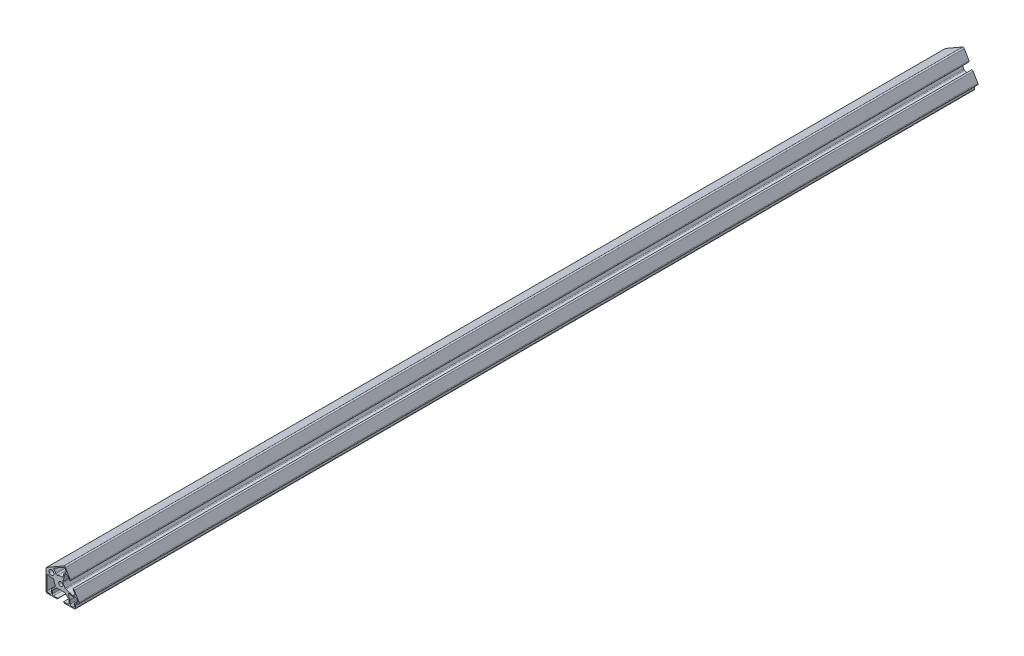
from build123d import *

# Parameters (mm, degrees)
SKETCH1_R           = 2.092304845
BOSS_EXTRUDE1_DEPTH = 913.638
FILLET1_R           = 1.27
FILLET2_R           = 1.27
FILLET3_R           = 1.27
FILLET4_R           = 1.27
FILLET5_R           = 1.27
FILLET6_R           = 1.27
FILLET7_R           = 1.27
FILLET8_R           = 1.27
FILLET9_R           = 1.27
FILLET10_R          = 1.27
FILLET11_R          = 1.27
FILLET12_R          = 1.27


with BuildPart() as part:
    # Sketch1 → Boss-Extrude1 (new body)
    with BuildSketch(Plane.XY):
        Polygon((-5.709111752, 22.288452484), (-4.843086348, 22.788452484), (-10.843086348, 33.180757329), (-30.000008327, 22.120503268), (-30.000008327, 0), (-18.0000002, 0), (-18.0000002, 1), (-23.500000006, 1), (-23.500000006, 5.300000062), (-19.200000068, 9.6), (-10.7, 9.6), (-6.5, 5.4), (-6.5, 1), (-11.999999876, 1), (-11.999999876, 0), (0, 0), (0, 4.8), (4.156920206, 7.199999), (-1.843078924, 17.592302339), (-2.709103466, 17.092304845), (0.040888209, 12.329160408), (-2.350417658, 10.948553557), (-10.326319052, 13.085689909), (-12.987541577, 17.695062532), (-10.850405232, 25.670963952), (-8.459105552, 27.051581466), align=None)
        with BuildLine():
            Line((-24.500008532, 1), (-29.00000835, 1))
            Line((-29.00000835, 1), (-29.00000835, 19.456837393))
            ThreePointArc((-29.00000835, 19.456837393), (-26.689110252, 16.43231636), (-22.891878185, 16.169626182))
            ThreePointArc((-22.891878185, 16.169626182), (-22.194595414, 16.497090044), (-21.561428455, 16.935878658))
            ThreePointArc((-21.561428455, 16.935878658), (-21.66355866, 13.451778233), (-20.035811579, 10.369599493))
            Line((-20.035811579, 10.369599493), (-20.872797194, 9.599995438))
            Line((-20.872797194, 9.599995438), (-24.500008532, 5.9727841))
            Line((-24.500008532, 5.9727841), (-24.500008532, 1))
        make_face(mode=Mode.SUBTRACT)
        with Locations((-15.000008327, 14.999995205)):
            Circle(SKETCH1_R, mode=Mode.SUBTRACT)
        with BuildLine():
            Line((-2.209115566, 9.875409102), (0.540892748, 11.463127143))
            Line((0.540892748, 11.463127143), (2.790879962, 7.566015836))
            Line((2.790879962, 7.566015836), (-1, 5.377350269))
            Line((-1, 5.377350269), (-1, 1))
            Line((-1, 1), (-5.5, 1))
            Line((-5.5, 1), (-5.5, 5.752344548))
            Line((-5.5, 5.752344548), (-7.208180578, 8.711011985))
            ThreePointArc((-7.208180578, 8.711011985), (-6.939845297, 10.769055524), (-4.872208764, 10.588982774))
            Line((-4.872208764, 10.588982774), (-2.209115566, 9.875409102))
        make_face(mode=Mode.SUBTRACT)
        with BuildLine():
            ThreePointArc((-25.041331703, 18.059304934), (-26.0647274, 22.449778327), (-22.000008327, 20.499995205))
            ThreePointArc((-22.000008327, 20.499995205), (-22.935289253, 18.550212084), (-25.041331703, 18.059304934))
        make_face(mode=Mode.SUBTRACT)
        with BuildLine():
            Line((-11.209111752, 31.814731926), (-8.959116197, 27.917625308))
            Line((-8.959116197, 27.917625308), (-11.709116867, 26.329911808))
            Line((-11.709116867, 26.329911808), (-12.992600022, 21.539887463))
            ThreePointArc((-12.992600022, 21.539887463), (-16.72657734, 21.619575123), (-19.945942173, 19.726264054))
            ThreePointArc((-19.945942173, 19.726264054), (-20.570023631, 22.927627533), (-23.153409445, 24.918688437))
            Line((-23.153409445, 24.918688437), (-11.209111752, 31.814731926))
        make_face(mode=Mode.SUBTRACT)
    extrude(amount=BOSS_EXTRUDE1_DEPTH)

    # Fillet1
    fillet1_edges = [part.edges().sort_by_distance(p)[0] for p in [
        (-11.709116867, 26.329911808, 456.819),
        (-11.209111752, 31.814731926, 456.819),
        (4.156920206, 7.199999, 456.819),
        (0, 0, 456.819),
        (-10.7, 9.6, 456.819),
        (-19.200000068, 9.6, 456.819),
        (-30.000008327, 0, 456.819),
        (-30.000008327, 22.120503268, 456.819),
        (-2.209115566, 9.875409102, 456.819),
    ]]
    fillet(fillet1_edges, radius=FILLET1_R)

    # Fillet2
    # the kernel refuses this fillet: 1.27 mm, written as the material it adds along each edge
    with BuildSketch(Plane(origin=(-6.5, 5.4, 0), x_dir=(-0.7071067811865475, 0.7071067811865475, 0), z_dir=(0, 0, 1))) as fillet2_piece_1:
        with BuildLine():
            CenterArc((FILLET2_R * 0.414213562373, FILLET2_R), FILLET2_R, 225, 45)
            Line((-FILLET2_R * 0.292893218813, FILLET2_R * 0.292893218813), (-FILLET2_R * 0.307035354437, FILLET2_R * 0.27875108319))
            Line((-FILLET2_R * 0.307035354437, FILLET2_R * 0.27875108319), (-FILLET2_R * 0.00828427124746, -FILLET2_R * 0.02))
            Line((-FILLET2_R * 0.00828427124746, -FILLET2_R * 0.02), (FILLET2_R * 0.414213562373, -FILLET2_R * 0.02))
            Line((FILLET2_R * 0.414213562373, -FILLET2_R * 0.02), (FILLET2_R * 0.414213562373, 0))
        make_face()
    extrude(amount=913.638)
    # the kernel refuses this fillet: 1.27 mm, written as the material it adds along each edge
    with BuildSketch(Plane(origin=(-20.035811579, 10.369599493, 0), x_dir=(-0.736116223784905, -0.6768551581251718, 0), z_dir=(0, 0, 1))) as fillet2_2_piece_1:
        with BuildLine():
            CenterArc((1.170024806, -1.269571301), FILLET2_R, 91.488758863, 79.506059356)
            Line((-0.084321413, -1.070786087), (-0.109408338, -1.066810383))
            ThreePointArc((-0.109408338, -1.066810383), (-0.046434543, -0.535056491), (-0.0254, 0))
            Line((-0.0254, 0), (0, 0.0254))
            ThreePointArc((0, 0.0254), (0.568514582, 0.0254), (1.136369252, 0.025391426))
            Line((1.136369252, 0.025391426), (1.137029165, 0))
        make_face()
    extrude(amount=913.638)
    # the kernel refuses this fillet: 1.27 mm, written as the material it takes off along each edge
    with BuildSketch(Plane(origin=(-24.500008532, 5.9727841, -1.315128061), x_dir=(0, -1, 0), z_dir=(0, 0, 1))) as fillet2_3_piece_1:
        with BuildLine():
            CenterArc((FILLET2_R * 0.414213562373, FILLET2_R), FILLET2_R, 225, 45)
            Line((-FILLET2_R * 0.292893218813, FILLET2_R * 0.292893218813), (-FILLET2_R * 0.307035354437, FILLET2_R * 0.27875108319))
            Line((-FILLET2_R * 0.307035354437, FILLET2_R * 0.27875108319), (-FILLET2_R * 0.00828427124746, -FILLET2_R * 0.02))
            Line((-FILLET2_R * 0.00828427124746, -FILLET2_R * 0.02), (FILLET2_R * 0.414213562373, -FILLET2_R * 0.02))
            Line((FILLET2_R * 0.414213562373, -FILLET2_R * 0.02), (FILLET2_R * 0.414213562373, 0))
        make_face()
    extrude(amount=916.268256121, mode=Mode.SUBTRACT)

    # Fillet3
    fillet3_edges = [part.edges().sort_by_distance(p)[0] for p in [
        (-23.500000006, 5.300000062, 456.819),
        (-10.850405232, 25.670963952, 456.819),
        (-12.987541577, 17.695062532, 456.819),
    ]]
    fillet(fillet3_edges, radius=FILLET3_R)

    # Fillet4
    fillet4_edges = [part.edges().sort_by_distance(p)[0] for p in [
        (-10.326319052, 13.085689909, 456.819),
        (-2.350417658, 10.948553557, 456.819),
    ]]
    fillet(fillet4_edges, radius=FILLET4_R)

    # Fillet5
    fillet5_edges = [part.edges().sort_by_distance(p)[0] for p in [
        (2.790879962, 7.566015836, 456.819),
        (0.540892748, 11.463127143, 456.819),
        (-1, 5.377350269, 456.819),
        (-4.872208764, 10.588982774, 456.819),
    ]]
    fillet(fillet5_edges, radius=FILLET5_R)

    # Fillet6
    fillet6_edges = [part.edges().sort_by_distance(p)[0] for p in [
        (-29.00000835, 1, 456.819),
        (-24.500008532, 1, 456.819),
        (-6.5, 1, 456.819),
        (-23.500000006, 1, 456.819),
        (-5.5, 5.752344548, 456.819),
        (-5.5, 1, 456.819),
        (-1, 1, 456.819),
    ]]
    fillet(fillet6_edges, radius=FILLET6_R)

    # Fillet7
    fillet7_edges = [part.edges().sort_by_distance(p)[0] for p in [
        (-8.959116197, 27.917625308, 456.819),
        (-19.945942173, 19.726264054, 456.819),
        (-12.992600022, 21.539887463, 456.819),
        (-21.561428455, 16.935878658, 456.819),
        (0.040888209, 12.329160408, 456.819),
        (-8.459105552, 27.051581466, 456.819),
    ]]
    fillet(fillet7_edges, radius=FILLET7_R)

    # Fillet8
    fillet8_edges = [part.edges().sort_by_distance(p)[0] for p in [
        (-23.153409445, 24.918688437, 456.819),
        (0, 4.8, 456.819),
    ]]
    fillet(fillet8_edges, radius=FILLET8_R)

    # Fillet9
    fillet9_edges = [part.edges().sort_by_distance(p)[0] for p in [
        (-29.00000835, 19.456837393, 456.819),
    ]]
    fillet(fillet9_edges, radius=FILLET9_R)

    # Fillet10
    # the kernel refuses this fillet: 1.27 mm, written as the material it takes off along each edge
    with BuildSketch(Plane(origin=(-11.999999876, 0, -3.102418412), x_dir=(1, 0, 0), z_dir=(0, 0, 1))) as fillet10_piece_1:
        with BuildLine():
            CenterArc((1.240967365, 1.27), FILLET10_R, 192.274670215, 77.725329785)
            Line((0, 1), (-0.024819347, 0.9946))
            ThreePointArc((-0.024819347, 0.9946), (-0.0254, 0.5), (-0.0254, 0))
            Line((-0.0254, 0), (0, -0.0254))
            Line((0, -0.0254), (1.240967365, -0.0254))
            Line((1.240967365, -0.0254), (1.240967365, 0))
        make_face()
    extrude(amount=919.842836823, mode=Mode.SUBTRACT)
    with BuildSketch(Plane(origin=(-18.0000002, 0, -3.102418412), x_dir=(-3.741007503773801e-12, 1.0, 0), z_dir=(0, 0, 1))) as fillet10_piece_2:
        with BuildLine():
            CenterArc((1.27, 1.240967365), FILLET10_R, 180, 77.725329785)
            Line((0, 1.240967365), (-0.0254, 1.240967365))
            Line((-0.0254, 1.240967365), (-0.0254, 0))
            Line((-0.0254, 0), (0, -0.0254))
            ThreePointArc((0, -0.0254), (0.5, -0.0254), (0.9946, -0.024819347))
            Line((0.9946, -0.024819347), (1, 0))
        make_face()
    extrude(amount=919.842836823, mode=Mode.SUBTRACT)

    # Fillet11
    # the kernel refuses this fillet: 1.27 mm, written as the material it takes off along each edge
    with BuildSketch(Plane(origin=(-4.843086348, 22.788452484, -3.102418412), x_dir=(-0.8660254037863125, -0.49999999999675426, 0), z_dir=(0, 0, 1))) as fillet11_piece_1:
        with BuildLine():
            CenterArc((1.27, -1.240967365), FILLET11_R, 102.274670215, 77.725329785)
            Line((0, -1.240967365), (-0.0254, -1.240967365))
            Line((-0.0254, -1.240967365), (-0.0254, 0))
            Line((-0.0254, 0), (0, 0.0254))
            ThreePointArc((0, 0.0254), (0.5, 0.0254), (0.9946, 0.024819347))
            Line((0.9946, 0.024819347), (1, 0))
        make_face()
    extrude(amount=919.842836823, mode=Mode.SUBTRACT)
    with BuildSketch(Plane(origin=(-1.843078924, 17.592302339, -3.102412974), x_dir=(0.499999999999999, -0.8660254037844393, 0), z_dir=(0, 0, 1))) as fillet11_piece_2:
        with BuildLine():
            CenterArc((1.24096519, -1.27), FILLET11_R, 90, 77.725237445)
            Line((-1.74e-06, -0.999998), (-0.024821078, -0.99459796))
            ThreePointArc((-0.024821078, -0.99459796), (-0.02540087, -0.499998956), (-0.0254, 4.4e-08))
            Line((-0.0254, 4.4e-08), (0, 0.0254))
            Line((0, 0.0254), (1.24096519, 0.0254))
            Line((1.24096519, 0.0254), (1.24096519, 0))
        make_face()
    extrude(amount=919.842825949, mode=Mode.SUBTRACT)

    # Fillet12
    fillet12_edges = [part.edges().sort_by_distance(p)[0] for p in [
        (-10.843086348, 33.180757329, 456.819),
    ]]
    fillet(fillet12_edges, radius=FILLET12_R)


solid = part.part
